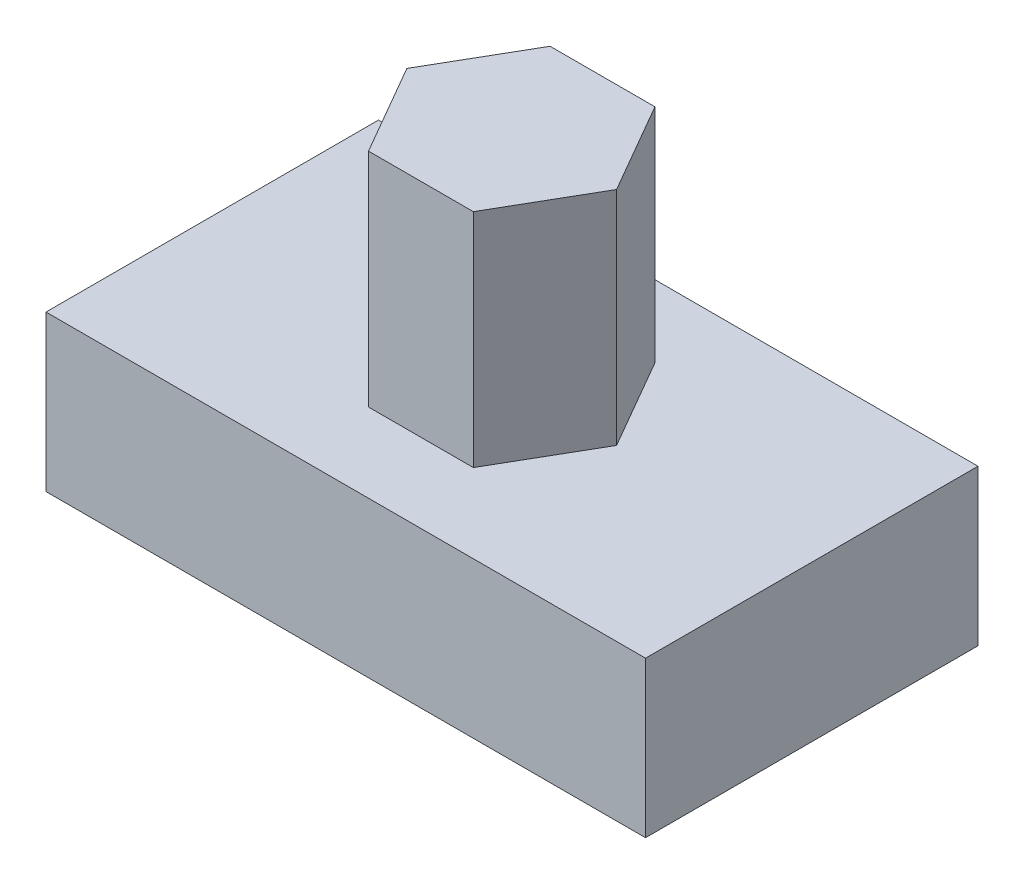
from build123d import *

# Parameters (mm, degrees)
SKETCH1_W           = 137.407001984
SKETCH1_H           = 35.641957088
BOSS_EXTRUDE1_DEPTH = 76.2
BOSS_EXTRUDE2_DEPTH = 50.8


with BuildPart() as part:
    # Sketch1 → Boss-Extrude1 (new body)
    with BuildSketch(Plane.XY):
        Rectangle(SKETCH1_W, SKETCH1_H)
    extrude(amount=BOSS_EXTRUDE1_DEPTH)

    # Sketch2 → Boss-Extrude2 (add)
    with BuildSketch(Plane(origin=(0, 17.820978544, 0), x_dir=(1, 0, 0), z_dir=(0, 1, 0))):
        Polygon((23.159003861, -37.290679973), (11.143714224, -16.479587852), (-12.886865052, -16.479587852), (-24.90215469, -37.290679973), (-12.886865052, -58.101772093), (11.143714224, -58.101772093), align=None)
    extrude(amount=BOSS_EXTRUDE2_DEPTH)


solid = part.part
